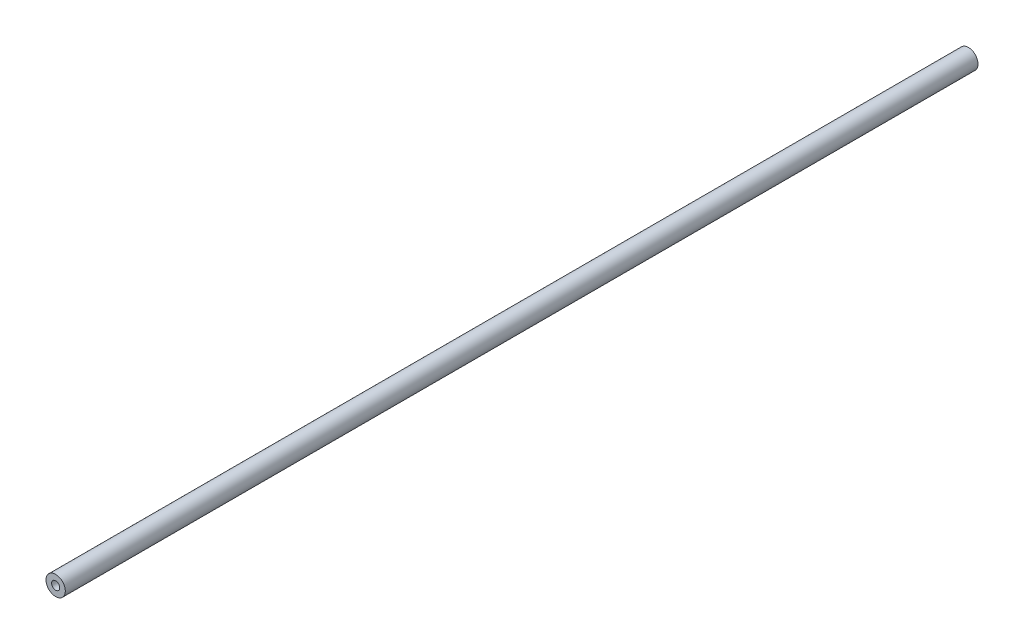
from build123d import *

# Parameters (mm, degrees)
SKETCH1_R                            = 4.7625
BOSS_EXTRUDE1_DEPTH                  = 450.85
F_10_32_TAPPED_HOLE1_D               = 4.0386
F_10_32_TAPPED_HOLE1_DEPTH           = 15.07744
F_10_32_TAPPED_HOLE1_TIP             = 1.213317848
F_10_32_TAPPED_HOLE1_ON_FACE_2_D     = 4.0386
F_10_32_TAPPED_HOLE1_ON_FACE_2_DEPTH = 15.07744
F_10_32_TAPPED_HOLE1_ON_FACE_2_TIP   = 1.213317848


with BuildPart() as part:
    # Sketch1 → Boss-Extrude1 (new body)
    with BuildSketch(Plane.XY):
        Circle(SKETCH1_R)
    extrude(amount=BOSS_EXTRUDE1_DEPTH)

    # #10-32 Tapped Hole1
    with Locations(Plane.XY.offset(450.85)):
        with Locations((0, 0)):
            Hole(F_10_32_TAPPED_HOLE1_D / 2, depth=F_10_32_TAPPED_HOLE1_DEPTH)
            with Locations((0, 0, -(F_10_32_TAPPED_HOLE1_DEPTH + F_10_32_TAPPED_HOLE1_TIP / 2))):  # 118° drill point
                Cone(0, F_10_32_TAPPED_HOLE1_D / 2, F_10_32_TAPPED_HOLE1_TIP, mode=Mode.SUBTRACT)

    # #10-32 Tapped Hole1 on face 2
    with Locations(Plane(origin=(0, 0, 0), x_dir=(-1, 0, 0), z_dir=(0, 0, -1))):
        with Locations((0, 0)):
            Hole(F_10_32_TAPPED_HOLE1_ON_FACE_2_D / 2, depth=F_10_32_TAPPED_HOLE1_ON_FACE_2_DEPTH)
            with Locations((0, 0, -(F_10_32_TAPPED_HOLE1_ON_FACE_2_DEPTH + F_10_32_TAPPED_HOLE1_ON_FACE_2_TIP / 2))):  # 118° drill point
                Cone(0, F_10_32_TAPPED_HOLE1_ON_FACE_2_D / 2, F_10_32_TAPPED_HOLE1_ON_FACE_2_TIP, mode=Mode.SUBTRACT)


solid = part.part
